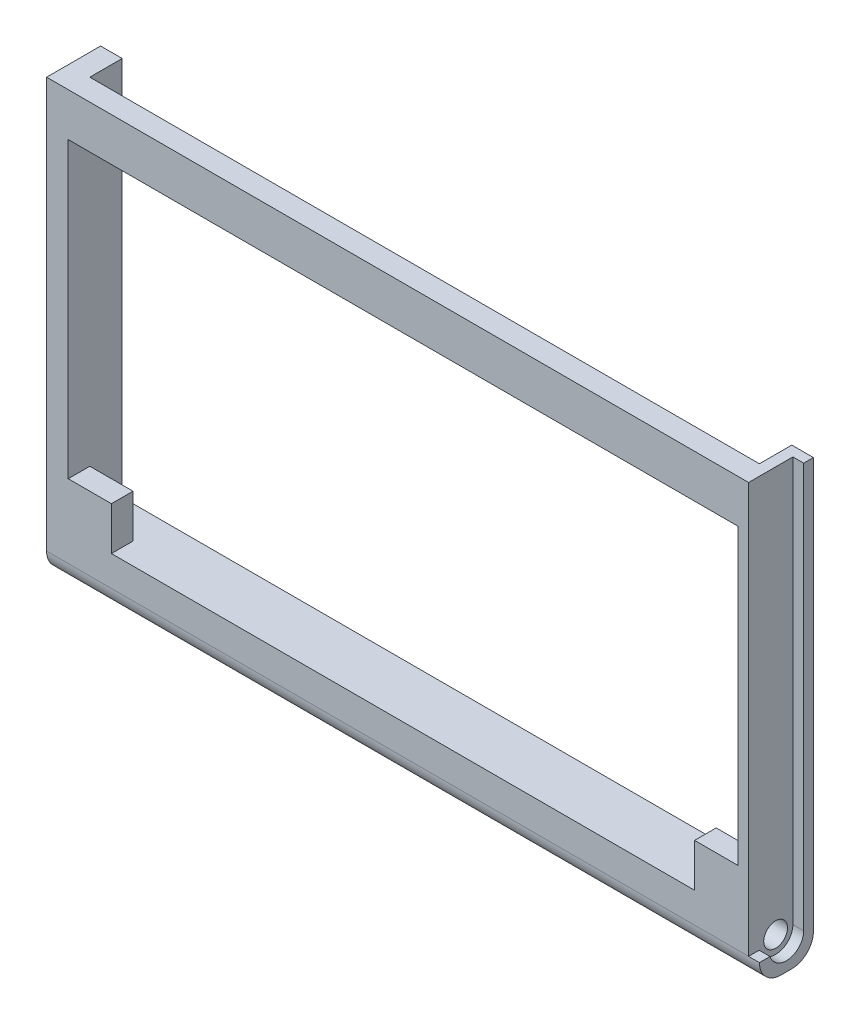
from build123d import *

# Parameters (mm, degrees)
SKETCH_1_W          = 33
SKETCH_1_H          = 20
EXTRUDE_1_DEPTH     = 2.5
SKETCH_2_W          = 31
SKETCH_2_H          = 17.6
CUT_EXTRUDE_1_DEPTH = 2.5
SKETCH_4_W          = 1
SKETCH_4_H          = 2
EXTRUDE_2_DEPTH     = 31
SKETCH_5_W          = 1
SKETCH_5_H          = 2
EXTRUDE_3_DEPTH     = 2
SKETCH_6_W          = 1
SKETCH_6_H          = 2
EXTRUDE_4_DEPTH     = 2
SKETCH_7_R          = 0.55
CUT_EXTRUDE_2_DEPTH = 35.572387826
FILLET_3_R          = 1
FILLET_4_R          = 1
SKETCH_8_R          = 0.8
CUT_EXTRUDE_3_DEPTH = 0.5
CUT_EXTRUDE_4_DEPTH = 0.5


with BuildPart() as part:
    # 草图1 → 凸台-拉伸1 (new body)
    with BuildSketch(Plane.XY):
        Rectangle(SKETCH_1_W, SKETCH_1_H)
    extrude(amount=EXTRUDE_1_DEPTH)

    # 草图2 → 切除-拉伸1 (cut)
    with BuildSketch(Plane.XY.offset(2.5)):
        with Locations((0, 1.2)):
            Rectangle(SKETCH_2_W, SKETCH_2_H)
    extrude(amount=-CUT_EXTRUDE_1_DEPTH, mode=Mode.SUBTRACT)

    # 草图4 → 凸台-拉伸2 (add)
    with BuildSketch(Plane.ZY.offset(-15.5)):
        with Locations((2, 9)):
            Rectangle(SKETCH_4_W, SKETCH_4_H)
    extrude(amount=EXTRUDE_2_DEPTH)

    # 草图5 → 凸台-拉伸3 (add)
    with BuildSketch(Plane.ZY.offset(-15.5)):
        with Locations((2, -6.6)):
            Rectangle(SKETCH_5_W, SKETCH_5_H)
    extrude(amount=EXTRUDE_3_DEPTH)

    # 草图6 → 凸台-拉伸4 (add)
    with BuildSketch(Plane(origin=(-15.5, 0, 0), x_dir=(0, 0, -1), z_dir=(1, 0, 0))):
        with Locations((-2, -6.6)):
            Rectangle(SKETCH_6_W, SKETCH_6_H)
    extrude(amount=EXTRUDE_4_DEPTH)

    # 草图7 → 切除-拉伸2 (cut, through all)
    with BuildSketch(Plane.ZY.offset(16.5)):
        with Locations((1.25, -8.75)):
            Circle(SKETCH_7_R)
    extrude(amount=-CUT_EXTRUDE_2_DEPTH, mode=Mode.SUBTRACT)

    # 圆角3
    fillet_3_edges = [part.edges().sort_by_distance(p)[0] for p in [
        (0, -10, 0),
    ]]
    fillet(fillet_3_edges, radius=FILLET_3_R)

    # 圆角4
    fillet_4_edges = [part.edges().sort_by_distance(p)[0] for p in [
        (0, -10, 2.5),
    ]]
    fillet(fillet_4_edges, radius=FILLET_4_R)

    # 草图8 → 切除-拉伸3 (cut)
    with BuildSketch(Plane(origin=(16.5, 0, 0), x_dir=(0, 0, -1), z_dir=(1, 0, 0))):
        with Locations((-1.25, -8.75)):
            Circle(SKETCH_8_R)
    extrude(amount=-CUT_EXTRUDE_3_DEPTH, mode=Mode.SUBTRACT)

    # 草图9 → 切除-拉伸4 (cut)
    with BuildSketch(Plane(origin=(16.5, 0, 0), x_dir=(0, 0, -1), z_dir=(1, 0, 0))):
        with BuildLine():
            Line((-0.45, -8.75), (-0.45, 10))
            Line((-0.45, 10), (-2.5, 10))
            Line((-2.5, 10), (-2.5, -9))
            Line((-2.5, -9), (-2.009934208, -9))
            ThreePointArc((-2.009934208, -9), (-1.37659509, -7.960079951), (-0.45, -8.75))
        make_face()
    extrude(amount=-CUT_EXTRUDE_4_DEPTH, mode=Mode.SUBTRACT)


solid = part.part
